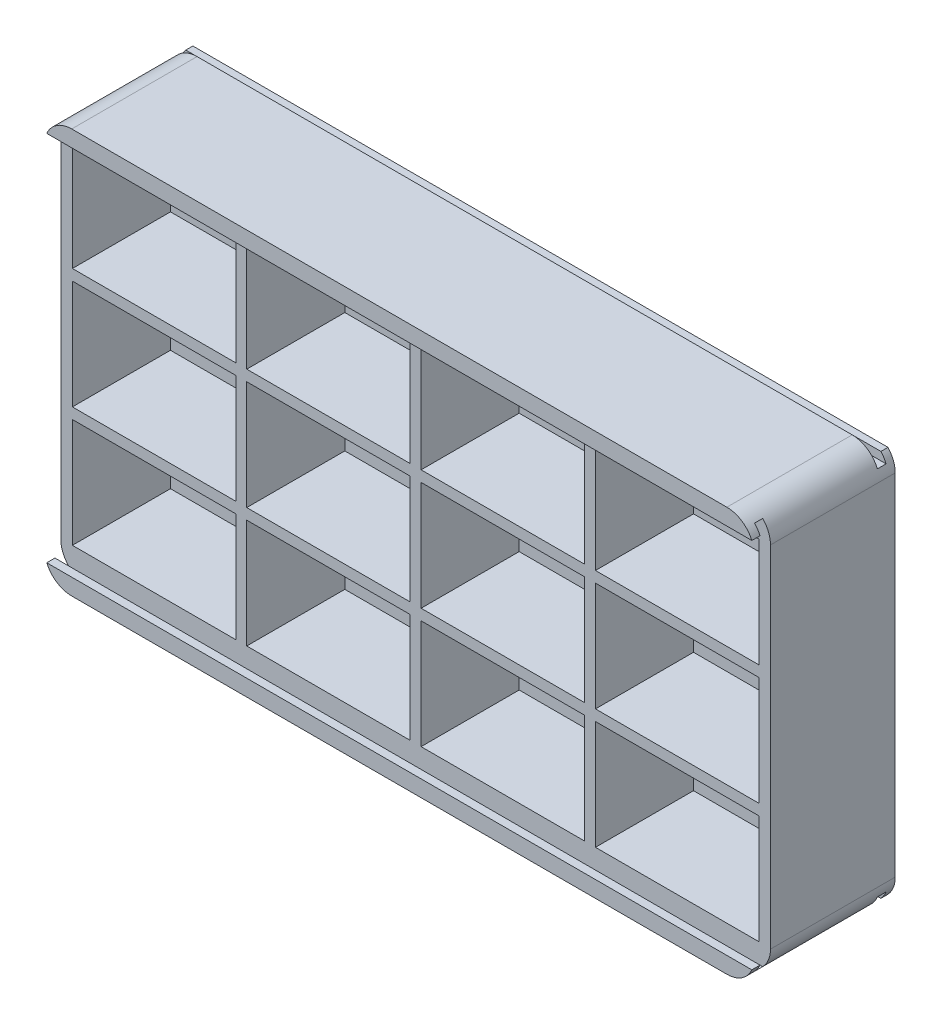
from build123d import *

# Parameters (mm, degrees)
CROQUIS1_W           = 130.242640688
CROQUIS1_H           = 68.242640688
CROQUIS1_W_2         = 30
CROQUIS1_H_2         = 20
CELDAS_DEPTH         = 20
BASE_START           = -128.12132
CROQUIS2_W           = 2
CROQUIS2_H           = 68.242640688
BASE_DEPTH           = 126
EXCEDENTE_DEPTH      = 3
EXCEDENTE_DEPTH_BACK = 20
CROQUIS3_W           = 130.242640688
CROQUIS3_H           = 3
CROQUIS4_W           = 1.5
CROQUIS4_H           = 71.242640688
RANURA_DEPTH         = 150.231036917
PESTA_A_DEPTH        = 130.242641
F_3D_FIX_DEPTH       = 150.23103719
REDONDEO_R           = 5


with BuildPart() as part:
    # Croquis1 → Celdas (new body)
    with BuildSketch(Plane.XY):
        with Locations((63, -32)):
            Rectangle(CROQUIS1_W, CROQUIS1_H)
        with Locations((47, -10)):
            Rectangle(CROQUIS1_W_2, CROQUIS1_H_2, mode=Mode.SUBTRACT)
        with Locations((15, -10)):
            Rectangle(CROQUIS1_W_2, CROQUIS1_H_2, mode=Mode.SUBTRACT)
        with Locations((79, -10)):
            Rectangle(CROQUIS1_W_2, CROQUIS1_H_2, mode=Mode.SUBTRACT)
        with Locations((111, -10)):
            Rectangle(CROQUIS1_W_2, CROQUIS1_H_2, mode=Mode.SUBTRACT)
        with Locations((47, -32)):
            Rectangle(CROQUIS1_W_2, CROQUIS1_H_2, mode=Mode.SUBTRACT)
        with Locations((79, -32)):
            Rectangle(CROQUIS1_W_2, CROQUIS1_H_2, mode=Mode.SUBTRACT)
        with Locations((111, -32)):
            Rectangle(CROQUIS1_W_2, CROQUIS1_H_2, mode=Mode.SUBTRACT)
        with Locations((47, -54)):
            Rectangle(CROQUIS1_W_2, CROQUIS1_H_2, mode=Mode.SUBTRACT)
        with Locations((79, -54)):
            Rectangle(CROQUIS1_W_2, CROQUIS1_H_2, mode=Mode.SUBTRACT)
        with Locations((111, -54)):
            Rectangle(CROQUIS1_W_2, CROQUIS1_H_2, mode=Mode.SUBTRACT)
        with Locations((15, -32)):
            Rectangle(CROQUIS1_W_2, CROQUIS1_H_2, mode=Mode.SUBTRACT)
        with Locations((15, -54)):
            Rectangle(CROQUIS1_W_2, CROQUIS1_H_2, mode=Mode.SUBTRACT)
    extrude(amount=CELDAS_DEPTH)


with BuildPart() as base_tool:
    # Croquis2 → Base (new body)
    with BuildSketch(Plane(origin=(128.121320344, 0, 0), x_dir=(0, 0, -1), z_dir=(1, 0, 0)).offset(BASE_START)):
        with Locations((-1, -32)):
            Rectangle(CROQUIS2_W, CROQUIS2_H)
    extrude(amount=BASE_DEPTH)


with BuildPart() as part_1:
    add(part.part)


with BuildPart() as part_2:
    # Base: joined with base_tool
    add(part_1.part.fuse(base_tool.part, tol=0.00001))

    # Croquis3 → Excedente (add, two sides: drawn at the far end of the back side and taken through both)
    with BuildSketch(Plane.XY.offset(20).offset(-EXCEDENTE_DEPTH_BACK)):
        with Locations((63, -67.621320344)):
            Rectangle(CROQUIS3_W, CROQUIS3_H)
        with Locations((63, 3.621320344)):
            Rectangle(CROQUIS3_W, CROQUIS3_H)
    extrude(amount=EXCEDENTE_DEPTH + EXCEDENTE_DEPTH_BACK)

    # Croquis4 → Ranura (cut, through all)
    with BuildSketch(Plane.ZY.offset(2.121320344)):
        with Locations((20.75, -32)):
            Rectangle(CROQUIS4_W, CROQUIS4_H)
    extrude(amount=-RANURA_DEPTH, mode=Mode.SUBTRACT)

    # Croquis6 → Pestaña (add, through all)
    with BuildSketch(Plane.ZY.offset(2.121320344)):
        Polygon((0, 2.121320344), (0, -66.121320344), (-1.5, -66.121320344), (-1.5, -67.621320344), (-3, -67.621320344), (-3, 3.621320344), (-1.5, 3.621320344), (-1.5, 2.121320344), align=None)
    extrude(amount=-PESTA_A_DEPTH)

    # Croquis7 → 3D-Fix (cut, through all)
    with BuildSketch(Plane.ZY.offset(2.121320344)):
        Polygon((-0.1, 2.021320344), (-1.6, 2.021320344), (-1.6, 3.521320344), (-2.9, 3.521320344), (-2.9, -67.521320344), (-1.6, -67.521320344), (-1.6, -66.021320344), (-0.1, -66.021320344), (0, -66.021320344), (0, -66.121320344), (-1.5, -66.121320344), (-1.5, -67.621320344), (-3, -67.621320344), (-3, 3.621320344), (-1.5, 3.621320344), (-1.5, 2.121320344), (0, 2.121320344), (0, 2.021320344), align=None)
    extrude(amount=-F_3D_FIX_DEPTH, mode=Mode.SUBTRACT)

    # Redondeo
    # the kernel refuses this fillet: 5 mm, written as the material it takes off along each edge
    with BuildSketch(Plane(origin=(128.121320344, 5.121320344, -12.5), x_dir=(0, -1, 0), z_dir=(0, 0, 1)), Plane(origin=(128.121320344, -69.121320344, 35.5), x_dir=(0, 1, 0), z_dir=(0, 0, -1)), Plane(origin=(-2.121320344, -69.121320344, -12.5), x_dir=(0, 1, 0), z_dir=(0, 0, 1))) as redondeo_piece_1:
        with BuildLine():
            CenterArc((REDONDEO_R, -REDONDEO_R), REDONDEO_R, 90, 90)
            Line((0, -REDONDEO_R), (0, 0))
            Line((0, 0), (REDONDEO_R, 0))
        make_face()
    extrude(amount=48, mode=Mode.SUBTRACT)
    with BuildSketch(Plane(origin=(-2.121320344, 5.121320344, 35.5), x_dir=(1, 0, 0), z_dir=(0, 0, -1))) as redondeo_piece_2:
        with BuildLine():
            CenterArc((REDONDEO_R, REDONDEO_R), REDONDEO_R, 180, 90)
            Line((0, REDONDEO_R), (0, 0))
            Line((0, 0), (REDONDEO_R, 0))
        make_face()
    extrude(amount=48, mode=Mode.SUBTRACT)


solid = part_2.part
